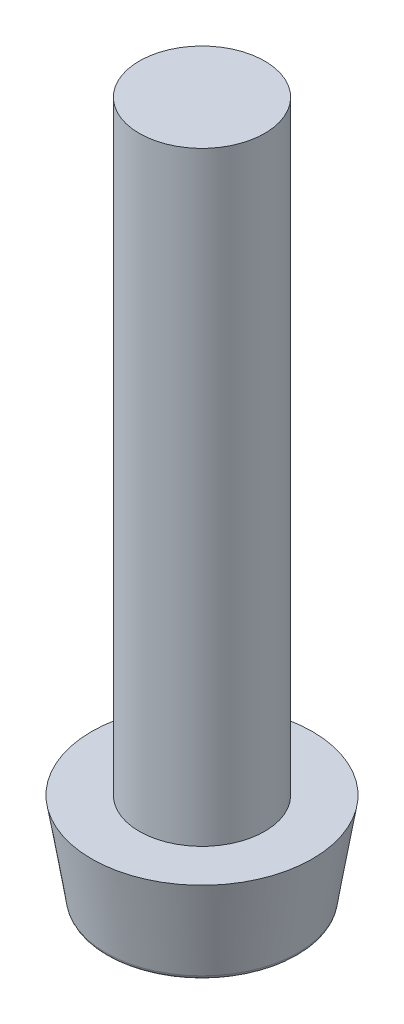
from build123d import *

# Parameters (mm, degrees)
ESQUISSE1_R        = 2.2
BOSS_EXTRU_1_DEPTH = 1.85
ESQUISSE2_R        = 1.25
BOSS_EXTRU_2_DEPTH = 12.05
CHANFREIN1_SIZE    = 1.85
CHANFREIN1_SIZE_2  = 0.3
CONG_1_R           = 0.1


with BuildPart() as part:
    # Esquisse1 → Boss.-Extru.1 (new body)
    with BuildSketch(Plane(origin=(0, 0, 0), x_dir=(1, 0, 0), z_dir=(0, 1, 0))):
        with Locations(Location((0, 0, 0), (0, 0, 270))):
            Circle(ESQUISSE1_R)
    extrude(amount=BOSS_EXTRU_1_DEPTH)

    # Esquisse2 → Boss.-Extru.2 (add)
    with BuildSketch(Plane(origin=(0, 1.85, 0), x_dir=(1, 0, 0), z_dir=(0, 1, 0))):
        with Locations(Location((0, 0, 0), (0, 0, 270))):
            Circle(ESQUISSE2_R)
    extrude(amount=BOSS_EXTRU_2_DEPTH)

    # Chanfrein1
    # the kernel refuses this chamfer: 1.85, 0.3 mm, written as the material it takes off along each edge
    with BuildSketch(Plane(origin=(0, 0, 0), x_dir=(0, 0, 1), z_dir=(-1, 0, 0))) as chanfrein1_piece_1:
        Polygon((2.2, CHANFREIN1_SIZE), (2.2 - CHANFREIN1_SIZE_2, 0), (2.2, 0), align=None)
    revolve(axis=Axis((0, 0, 0), (0, 1, 0)), mode=Mode.SUBTRACT)

    # Congé1
    cong_1_edges = [part.edges().sort_by_distance(p)[0] for p in [
        (0, 0, -1.9),
    ]]
    fillet(cong_1_edges, radius=CONG_1_R)


solid = part.part
